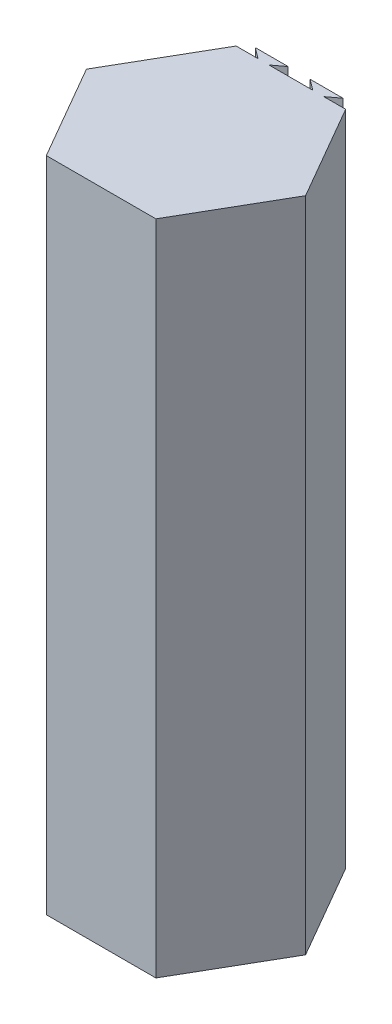
from build123d import *

# Parameters (mm, degrees)
BOSS_EXTRUDE1_DEPTH = 240
SHELL1_START        = 8
SHELL1_DEPTH        = 228
CUT_EXTRUDE1_REACH  = 248.205
SKETCH2_R           = 16


# Read off the part's stored shape, not the designer's step: Shell1
with BuildPart() as part:
    # Sketch1 → Boss-Extrude1 (new body)
    with BuildSketch(Plane(origin=(0, 0, 0), x_dir=(1, 0, 0), z_dir=(0, 1, 0))):
        Polygon((40, 0), (20, 34.641016151), (-20, 34.641016151), (-40, 0), (-20, -34.641016151), (20, -34.641016151), align=None)
        Polygon((-12, 34.641016151), (-8, 34.641016151), (-4, 37.641016151), (-16, 37.641016151), align=None)
        Polygon((4, 37.641016151), (16, 37.641016151), (12, 34.641016151), (8, 34.641016151), align=None)
    extrude(amount=BOSS_EXTRUDE1_DEPTH)

    # Shell1 outline → Shell1 (cut)
    with BuildSketch(Plane(origin=(0, 0, 0), x_dir=(1, 0, 0), z_dir=(0, 1, 0)).offset(SHELL1_START)):
        Polygon((-17.690598923, -30.641016151), (17.690598923, -30.641016151), (35.381197846, 0), (17.690598923, 30.641016151), (-17.690598923, 30.641016151), (-35.381197846, 0), align=None)
    extrude(amount=SHELL1_DEPTH, mode=Mode.SUBTRACT)

    # Sketch2 → Cut-Extrude1 (cut, up to next)
    with BuildSketch(Plane.XZ, mode=Mode.PRIVATE) as cut_extrude1_sk1:
        with Locations(Location((0, 0, 0), (0, 0, 270))):
            Circle(SKETCH2_R)
    cut_extrude1_tool1 = extrude(cut_extrude1_sk1.sketch, amount=-CUT_EXTRUDE1_REACH, mode=Mode.PRIVATE) & part.part
    add(cut_extrude1_tool1.solids().sort_by_distance((0, 0, 0))[0], mode=Mode.SUBTRACT)


solid = part.part
